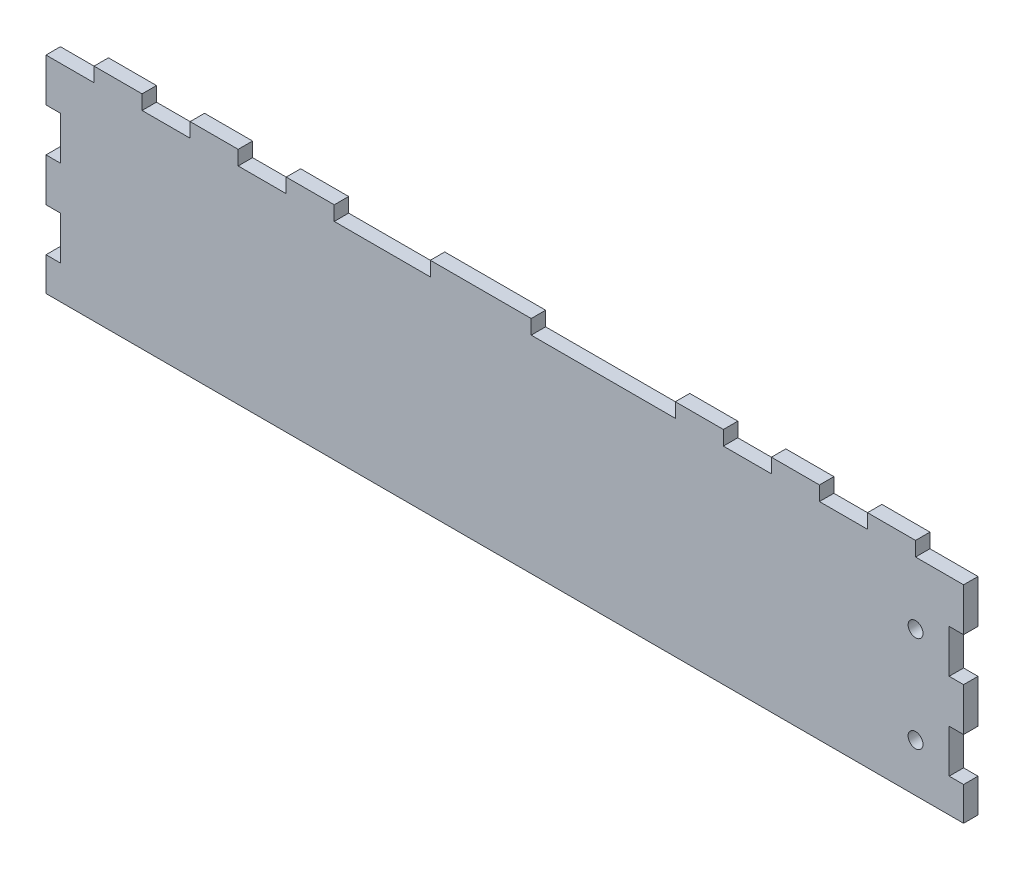
from build123d import *

# Parameters (mm, degrees)
SKETCH1_W           = 191
SKETCH1_H           = 46
SKETCH1_R           = 1.549999948
BOSS_EXTRUDE1_DEPTH = 3
CUT_EXTRUDE1_REACH  = 198.484
SKETCH4_W           = 10
SKETCH4_H           = 3
SKETCH4_W_2         = 20
SKETCH4_W_3         = 30
CUT_EXTRUDE2_REACH  = 198.484
SKETCH5_W           = 3
SKETCH5_H           = 9
CUT_EXTRUDE3_REACH  = 198.484
SKETCH6_W           = 3
SKETCH6_H           = 9


with BuildPart() as part:
    # Sketch1 → Boss-Extrude1 (new body)
    with BuildSketch(Plane.XY):
        with Locations((95.5, 23)):
            Rectangle(SKETCH1_W, SKETCH1_H)
        with Locations((181, 30)):
            Circle(SKETCH1_R, mode=Mode.SUBTRACT)
        with Locations((181, 10)):
            Circle(SKETCH1_R, mode=Mode.SUBTRACT)
    extrude(amount=BOSS_EXTRUDE1_DEPTH)

    # Sketch4 → Cut-Extrude1 (cut, up to next)
    with BuildSketch(Plane(origin=(0, 0, 0), x_dir=(-1, 0, 0), z_dir=(0, 0, -1)), mode=Mode.PRIVATE) as cut_extrude1_sk1:
        with Locations((-5, 44.5)):
            Rectangle(SKETCH4_W, SKETCH4_H)
    cut_extrude1_tool1 = extrude(cut_extrude1_sk1.sketch, amount=-CUT_EXTRUDE1_REACH, mode=Mode.PRIVATE) & part.part
    # Sketch4 → Cut-Extrude1 (cut, up to next)
    with BuildSketch(Plane(origin=(0, 0, 0), x_dir=(-1, 0, 0), z_dir=(0, 0, -1)), mode=Mode.PRIVATE) as cut_extrude1_sk2:
        with Locations((-25, 44.5)):
            Rectangle(SKETCH4_W, SKETCH4_H)
    cut_extrude1_tool2 = extrude(cut_extrude1_sk2.sketch, amount=-CUT_EXTRUDE1_REACH, mode=Mode.PRIVATE) & part.part
    # Sketch4 → Cut-Extrude1 (cut, up to next)
    with BuildSketch(Plane(origin=(0, 0, 0), x_dir=(-1, 0, 0), z_dir=(0, 0, -1)), mode=Mode.PRIVATE) as cut_extrude1_sk3:
        with Locations((-45, 44.5)):
            Rectangle(SKETCH4_W, SKETCH4_H)
    cut_extrude1_tool3 = extrude(cut_extrude1_sk3.sketch, amount=-CUT_EXTRUDE1_REACH, mode=Mode.PRIVATE) & part.part
    # Sketch4 → Cut-Extrude1 (cut, up to next)
    with BuildSketch(Plane(origin=(0, 0, 0), x_dir=(-1, 0, 0), z_dir=(0, 0, -1)), mode=Mode.PRIVATE) as cut_extrude1_sk4:
        with Locations((-70, 44.5)):
            Rectangle(SKETCH4_W_2, SKETCH4_H)
    cut_extrude1_tool4 = extrude(cut_extrude1_sk4.sketch, amount=-CUT_EXTRUDE1_REACH, mode=Mode.PRIVATE) & part.part
    # Sketch4 → Cut-Extrude1 (cut, up to next)
    with BuildSketch(Plane(origin=(0, 0, 0), x_dir=(-1, 0, 0), z_dir=(0, 0, -1)), mode=Mode.PRIVATE) as cut_extrude1_sk5:
        with Locations((-116, 44.5)):
            Rectangle(SKETCH4_W_3, SKETCH4_H)
    cut_extrude1_tool5 = extrude(cut_extrude1_sk5.sketch, amount=-CUT_EXTRUDE1_REACH, mode=Mode.PRIVATE) & part.part
    # Sketch4 → Cut-Extrude1 (cut, up to next)
    with BuildSketch(Plane(origin=(0, 0, 0), x_dir=(-1, 0, 0), z_dir=(0, 0, -1)), mode=Mode.PRIVATE) as cut_extrude1_sk6:
        with Locations((-146, 44.5)):
            Rectangle(SKETCH4_W, SKETCH4_H)
    cut_extrude1_tool6 = extrude(cut_extrude1_sk6.sketch, amount=-CUT_EXTRUDE1_REACH, mode=Mode.PRIVATE) & part.part
    # Sketch4 → Cut-Extrude1 (cut, up to next)
    with BuildSketch(Plane(origin=(0, 0, 0), x_dir=(-1, 0, 0), z_dir=(0, 0, -1)), mode=Mode.PRIVATE) as cut_extrude1_sk7:
        with Locations((-166, 44.5)):
            Rectangle(SKETCH4_W, SKETCH4_H)
    cut_extrude1_tool7 = extrude(cut_extrude1_sk7.sketch, amount=-CUT_EXTRUDE1_REACH, mode=Mode.PRIVATE) & part.part
    # Sketch4 → Cut-Extrude1 (cut, up to next)
    with BuildSketch(Plane(origin=(0, 0, 0), x_dir=(-1, 0, 0), z_dir=(0, 0, -1)), mode=Mode.PRIVATE) as cut_extrude1_sk8:
        with Locations((-186, 44.5)):
            Rectangle(SKETCH4_W, SKETCH4_H)
    cut_extrude1_tool8 = extrude(cut_extrude1_sk8.sketch, amount=-CUT_EXTRUDE1_REACH, mode=Mode.PRIVATE) & part.part
    add(cut_extrude1_tool1.solids().sort_by_distance((5, 44.5, 0))[0], mode=Mode.SUBTRACT)
    add(cut_extrude1_tool2.solids().sort_by_distance((25, 44.5, 0))[0], mode=Mode.SUBTRACT)
    add(cut_extrude1_tool3.solids().sort_by_distance((45, 44.5, 0))[0], mode=Mode.SUBTRACT)
    add(cut_extrude1_tool4.solids().sort_by_distance((70, 44.5, 0))[0], mode=Mode.SUBTRACT)
    add(cut_extrude1_tool5.solids().sort_by_distance((116, 44.5, 0))[0], mode=Mode.SUBTRACT)
    add(cut_extrude1_tool6.solids().sort_by_distance((146, 44.5, 0))[0], mode=Mode.SUBTRACT)
    add(cut_extrude1_tool7.solids().sort_by_distance((166, 44.5, 0))[0], mode=Mode.SUBTRACT)
    add(cut_extrude1_tool8.solids().sort_by_distance((186, 44.5, 0))[0], mode=Mode.SUBTRACT)

    # Sketch5 → Cut-Extrude2 (cut, up to next)
    with BuildSketch(Plane(origin=(0, 0, 0), x_dir=(-1, 0, 0), z_dir=(0, 0, -1)), mode=Mode.PRIVATE) as cut_extrude2_sk1:
        with Locations((-1.5, 29.5)):
            Rectangle(SKETCH5_W, SKETCH5_H)
    cut_extrude2_tool1 = extrude(cut_extrude2_sk1.sketch, amount=-CUT_EXTRUDE2_REACH, mode=Mode.PRIVATE) & part.part
    # Sketch5 → Cut-Extrude2 (cut, up to next)
    with BuildSketch(Plane(origin=(0, 0, 0), x_dir=(-1, 0, 0), z_dir=(0, 0, -1)), mode=Mode.PRIVATE) as cut_extrude2_sk2:
        with Locations((-1.5, 11.5)):
            Rectangle(SKETCH5_W, SKETCH5_H)
    cut_extrude2_tool2 = extrude(cut_extrude2_sk2.sketch, amount=-CUT_EXTRUDE2_REACH, mode=Mode.PRIVATE) & part.part
    add(cut_extrude2_tool1.solids().sort_by_distance((1.5, 29.5, 0))[0], mode=Mode.SUBTRACT)
    add(cut_extrude2_tool2.solids().sort_by_distance((1.5, 11.5, 0))[0], mode=Mode.SUBTRACT)

    # Sketch6 → Cut-Extrude3 (cut, up to next)
    with BuildSketch(Plane(origin=(0, 0, 0), x_dir=(-1, 0, 0), z_dir=(0, 0, -1)), mode=Mode.PRIVATE) as cut_extrude3_sk1:
        with Locations((-189.5, 29.5)):
            Rectangle(SKETCH6_W, SKETCH6_H)
    cut_extrude3_tool1 = extrude(cut_extrude3_sk1.sketch, amount=-CUT_EXTRUDE3_REACH, mode=Mode.PRIVATE) & part.part
    # Sketch6 → Cut-Extrude3 (cut, up to next)
    with BuildSketch(Plane(origin=(0, 0, 0), x_dir=(-1, 0, 0), z_dir=(0, 0, -1)), mode=Mode.PRIVATE) as cut_extrude3_sk2:
        with Locations((-189.5, 11.5)):
            Rectangle(SKETCH6_W, SKETCH6_H)
    cut_extrude3_tool2 = extrude(cut_extrude3_sk2.sketch, amount=-CUT_EXTRUDE3_REACH, mode=Mode.PRIVATE) & part.part
    add(cut_extrude3_tool1.solids().sort_by_distance((189.5, 29.5, 0))[0], mode=Mode.SUBTRACT)
    add(cut_extrude3_tool2.solids().sort_by_distance((189.5, 11.5, 0))[0], mode=Mode.SUBTRACT)


solid = part.part
